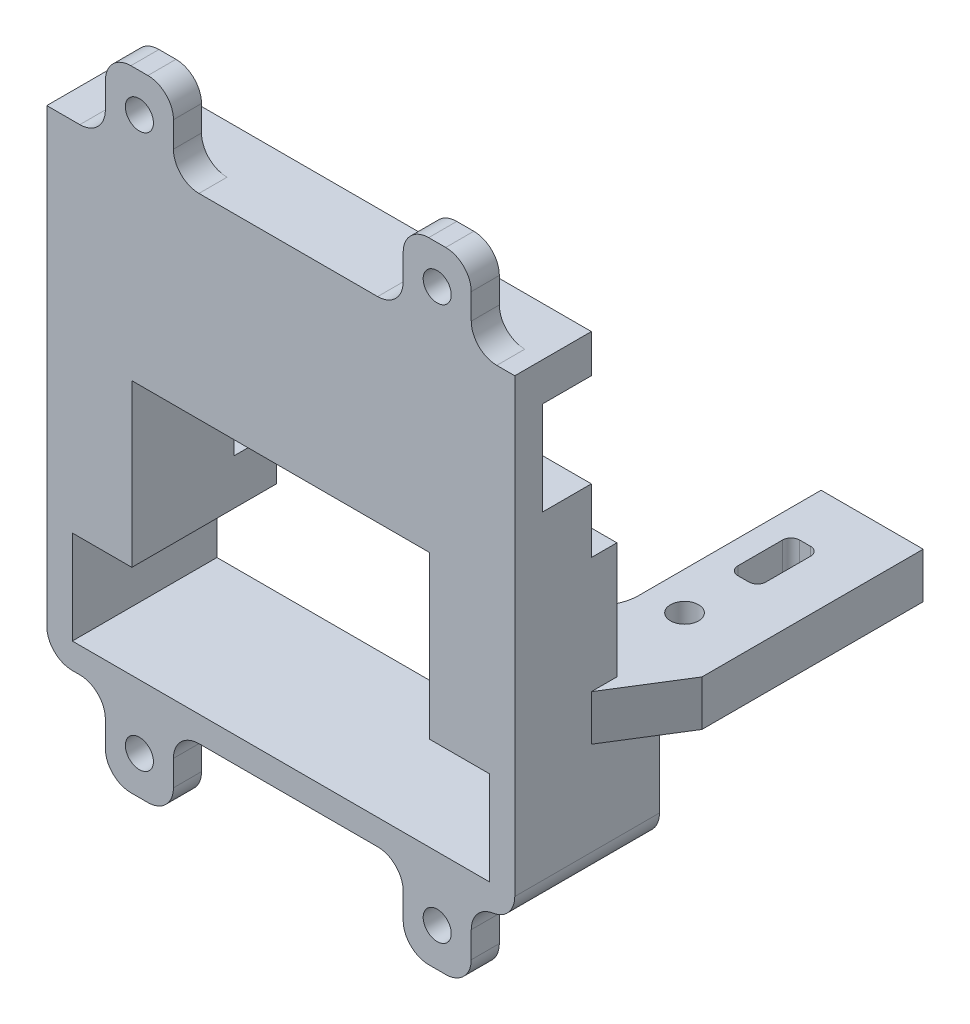
from build123d import *

# Parameters (mm, degrees)
SKETCH_1_W           = 7
SKETCH_1_H           = 21
SKETCH_1_R           = 1.65
EXTRUDE_1_DEPTH      = 3
EXTRUDE_1_2_DEPTH    = 3
SKETCH_2_W           = 55
SKETCH_2_H           = 30
EXTRUDE_2_DEPTH      = 3
SKETCH_3_W           = 55
SKETCH_3_H           = 30
EXTRUDE_3_DEPTH      = 14
SKETCH_4_W           = 55
SKETCH_4_H           = 17
EXTRUDE_4_DEPTH      = 22
SKETCH_5_W           = 66.735039671
SKETCH_5_H           = 6
CUT_EXTRUDE_1_DEPTH  = 13.75
CUT_EXTRUDE_2_DEPTH  = 20
SKETCH2_W            = 7
SKETCH2_H            = 21
SKETCH2_R            = 1.65
BOSS_EXTRUDE1_DEPTH  = 3
SKETCH3_W            = 7
SKETCH3_H            = 6
BOSS_EXTRUDE2_DEPTH  = 5
SKETCH4_W            = 3
SKETCH4_H            = 6
BOSS_EXTRUDE3_DEPTH  = 41
SKETCH5_W            = 8
SKETCH5_H            = 9
SKETCH5_R            = 1.65
BOSS_EXTRUDE4_DEPTH  = 3.3
FILLET1_R            = 5
FILLET2_R            = 3
FILLET3_R            = 3
SKETCH6_W            = 55
SKETCH6_H            = 17
BOSS_EXTRUDE5_DEPTH  = 4
MIRROR2_START        = 24.2
MIRROR2_OUTLINE_R    = 1.65
MIRROR2_DEPTH        = 3.3
FILLET4_R            = 3
SKETCH8_W            = 55
SKETCH8_H            = 7
CUT_EXTRUDE1_DEPTH   = 8
SKETCH10_R           = 1.65
BOSS_EXTRUDE6_DEPTH  = 10
CUT_EXTRUDE2_DEPTH   = 10
SKETCH12_W           = 55
SKETCH12_H           = 13.75
CUT_EXTRUDE3_DEPTH   = 2.5
CUT_EXTRUDE4_DEPTH   = 10
SKETCH15_W           = 41
SKETCH15_H           = 3
CUT_EXTRUDE5_DEPTH   = 60.476886267
SKETCH17_W           = 55
SKETCH17_H           = 5.75
CUT_EXTRUDE6_DEPTH   = 2.5
BOSS_EXTRUDE8_DEPTH  = 17
SKETCH19_W           = 55
SKETCH19_H           = 7.5
CUT_EXTRUDE8_DEPTH   = 8
SKETCH20_W           = 10
SKETCH20_H           = 13
CUT_EXTRUDE9_DEPTH   = 5
SKETCH16_W           = 26
SKETCH16_H           = 6
BOSS_EXTRUDE9_DEPTH  = 5
BOSS_EXTRUDE10_DEPTH = 6
SKETCH23_R           = 1.65
CUT_EXTRUDE10_DEPTH  = 0.65


# Read off the part's stored shape, not the designer's step: Mirror2
with BuildPart() as part:
    # 草图1 → 凸台-拉伸1 (new body)
    with BuildSketch(Plane(origin=(0, 0, 0), x_dir=(1, 0, 0), z_dir=(0, 1, 0))):
        with Locations((-24, 0)):
            Rectangle(SKETCH_1_W, SKETCH_1_H)
        with Locations(Location((-24.95, -5, 0), (0, 0, 270))):
            Circle(SKETCH_1_R, mode=Mode.SUBTRACT)
        with Locations(Location((-24.95, 5, 0), (0, 0, 270))):
            Circle(SKETCH_1_R, mode=Mode.SUBTRACT)
    extrude(amount=-EXTRUDE_1_DEPTH)



with BuildPart() as body_2:
    # 草图1 → Extrude 1 2 (new body)
    with BuildSketch(Plane(origin=(0, 0, 0), x_dir=(1, 0, 0), z_dir=(0, 1, 0))):
        with Locations((24, 0)):
            Rectangle(SKETCH_1_W, SKETCH_1_H)
        with Locations(Location((24.95, -5, 0), (0, 0, 270))):
            Circle(SKETCH_1_R, mode=Mode.SUBTRACT)
        with Locations(Location((24.95, 5, 0), (0, 0, 270))):
            Circle(SKETCH_1_R, mode=Mode.SUBTRACT)
    extrude(amount=-EXTRUDE_1_2_DEPTH)


with BuildPart() as part_1:
    add(part.part)

    add(body_2.part)  # 凸台-拉伸2 merges body 2
    # 草图2 → 凸台-拉伸2 (add)
    with BuildSketch(Plane.XY.offset(10.5)):
        with Locations((0, -15)):
            Rectangle(SKETCH_2_W, SKETCH_2_H)
    extrude(amount=EXTRUDE_2_DEPTH)

    # 草图3 → 凸台-拉伸3 (add)
    with BuildSketch(Plane.XY.offset(13.5)):
        with Locations((0, -15)):
            Rectangle(SKETCH_3_W, SKETCH_3_H)
    extrude(amount=EXTRUDE_3_DEPTH)

    # 草图4 → 凸台-拉伸4 (add)
    with BuildSketch(Plane(origin=(0, 0, 0), x_dir=(1, 0, 0), z_dir=(0, 1, 0))):
        with Locations((0, -19)):
            Rectangle(SKETCH_4_W, SKETCH_4_H)
    extrude(amount=EXTRUDE_4_DEPTH)

    # 草图5 → 切除-拉伸1 (cut)
    with BuildSketch(Plane(origin=(0, 0, 10.5), x_dir=(-1, 0, 0), z_dir=(0, 0, -1))):
        with Locations((1.017100612, 16)):
            Rectangle(SKETCH_5_W, SKETCH_5_H)
    extrude(amount=-CUT_EXTRUDE_1_DEPTH, mode=Mode.SUBTRACT)

    # 草图6 → 切除-拉伸2 (cut)
    with BuildSketch(Plane(origin=(0, 0, 10.5), x_dir=(-1, 0, 0), z_dir=(0, 0, -1))):
        Polygon((-24.5, 3), (-17.5, 3), (-17.5, -6), (-24.5, -6), (-24.5, -27), (24.5, -27), (24.5, -6), (17.5, -6), (17.5, 3), (24.5, 3), (24.5, 10), (-24.5, 10), align=None)
    extrude(amount=-CUT_EXTRUDE_2_DEPTH, mode=Mode.SUBTRACT)

    # Sketch2 → Boss-Extrude1 (add)
    # profile 1 of 2: a face of its own
    with BuildSketch(Plane.XZ.offset(3)):
        with Locations((24, 0)):
            Rectangle(SKETCH2_W, SKETCH2_H)
        with Locations(Location((24.95, -5, 0), (0, 0, 90))):
            Circle(SKETCH2_R, mode=Mode.SUBTRACT)
        with Locations(Location((24.95, 5, 0), (0, 0, 90))):
            Circle(SKETCH2_R, mode=Mode.SUBTRACT)
    # profile 2 of 2: a face of its own
    with BuildSketch(Plane.XZ.offset(3)):
        with Locations((-24, 0)):
            Rectangle(SKETCH2_W, SKETCH2_H)
        with Locations(Location((-24.95, -5, 0), (0, 0, 90))):
            Circle(SKETCH2_R, mode=Mode.SUBTRACT)
        with Locations(Location((-24.95, 5, 0), (0, 0, 90))):
            Circle(SKETCH2_R, mode=Mode.SUBTRACT)
    extrude(amount=BOSS_EXTRUDE1_DEPTH)

    # Sketch3 → Boss-Extrude2 (add)
    with BuildSketch(Plane(origin=(0, 0, -10.5), x_dir=(-1, 0, 0), z_dir=(0, 0, -1))):
        with Locations((-24, -3)):
            Rectangle(SKETCH3_W, SKETCH3_H)
        with Locations((24, -3)):
            Rectangle(SKETCH3_W, SKETCH3_H)
    extrude(amount=BOSS_EXTRUDE2_DEPTH)

    # Sketch4 → Boss-Extrude3 (add)
    with BuildSketch(Plane.ZY.offset(-20.5)):
        with Locations((-14, -3)):
            Rectangle(SKETCH4_W, SKETCH4_H)
    extrude(amount=BOSS_EXTRUDE3_DEPTH)

    # Sketch5 → Boss-Extrude4 (add)
    # profile 1 of 2: a face of its own
    with BuildSketch(Plane.XY.offset(27.5)):
        with Locations((18.383478606, -34.5)):
            Rectangle(SKETCH5_W, SKETCH5_H)
        with Locations((18.383478606, -34.5)):
            Circle(SKETCH5_R, mode=Mode.SUBTRACT)
    # profile 2 of 2: a face of its own
    with BuildSketch(Plane.XY.offset(27.5)):
        with Locations((-16.616521394, -34.5)):
            Rectangle(SKETCH5_W, SKETCH5_H)
        with Locations((-16.616521394, -34.5)):
            Circle(SKETCH5_R, mode=Mode.SUBTRACT)
    extrude(amount=-BOSS_EXTRUDE4_DEPTH)

    # Fillet1
    # the kernel refuses this fillet: 5 mm, written as the material it adds along each edge
    with BuildSketch(Plane(origin=(-20.5, 0, 10.5), x_dir=(1, 0, 0), z_dir=(0, -1, 0)), Plane(origin=(20.5, -6, 10.5), x_dir=(-1, 0, 0), z_dir=(0, 1, 0))) as fillet1_piece_1:
        with BuildLine():
            CenterArc((5, -4.582575695), FILLET1_R, 113.578178478, 66.421821522)
            Line((0, -4.582575695), (-0.1, -4.582575695))
            Line((-0.1, -4.582575695), (-0.1, 0))
            Line((-0.1, 0), (0, 0.1))
            ThreePointArc((0, 0.1), (1.5, 0.1), (2.96, 0.091651514))
            Line((2.96, 0.091651514), (3, 0))
        make_face()
    extrude(amount=6)

    # Fillet2
    fillet2_edges = [part_1.edges().sort_by_distance(p)[0] for p in [
        (24.5, 3, 19),
        (-24.5, 3, 19),
        (-27.5, -30, 19),
        (27.5, -30, 19),
    ]]
    fillet(fillet2_edges, radius=FILLET2_R)

    # Fillet3
    # the kernel refuses this fillet: 3 mm, written as the material it adds along each edge
    with BuildSketch(Plane(origin=(-20.616521394, -30, 27.5), x_dir=(-1, 0, 0), z_dir=(0, 0, -1)), Plane(origin=(14.383478606, -30, 27.5), x_dir=(-1, 0, 0), z_dir=(0, 0, -1))) as fillet3_piece_1:
        with BuildLine():
            CenterArc((FILLET3_R, -FILLET3_R), FILLET3_R, 90, 90)
            Line((0, -FILLET3_R), (0, 0))
            Line((0, 0), (FILLET3_R, 0))
        make_face()
    extrude(amount=3.3)
    with BuildSketch(Plane(origin=(-12.616521394, -30, 27.5), x_dir=(1, 0, 0), z_dir=(0, 0, -1))) as fillet3_piece_2:
        with BuildLine():
            CenterArc((FILLET3_R, FILLET3_R), FILLET3_R, 180, 90)
            Line((0, FILLET3_R), (0, 0))
            Line((0, 0), (FILLET3_R, 0))
        make_face()
    extrude(amount=3.3)
    with BuildSketch(Plane(origin=(22.383478606, -30, 27.5), x_dir=(0.9999183162467798, 0.012781268880858251, 0), z_dir=(0, 0, -1))) as fillet3_piece_3:
        with BuildLine():
            CenterArc((2.96224705, 2.97270312), FILLET3_R, 180.732332704, 81.532613054)
            Line((-0.037507899, 2.934359313), (-0.337483394, 2.930524932))
            Line((-0.337483394, 2.930524932), (-0.299975495, -0.003834381))
            Line((-0.299975495, -0.003834381), (0.003834381, -0.299975495))
            ThreePointArc((0.003834381, -0.299975495), (2.12018289, -0.272923666), (2.518091946, -0.297270312))
            Line((2.518091946, -0.297270312), (2.558469683, 0))
        make_face()
    extrude(amount=3.3)
    # the kernel refuses this fillet: 3 mm, written as the material it takes off along each edge
    with BuildSketch(Plane(origin=(-12.616521394, -39, 35), x_dir=(0, 1, 0), z_dir=(0, 0, -1)), Plane(origin=(-20.616521394, -39, 35), x_dir=(1, 0, 0), z_dir=(0, 0, -1)), Plane(origin=(22.383478606, -39, 35), x_dir=(0, 1, 0), z_dir=(0, 0, -1)), Plane(origin=(14.383478606, -39, 35), x_dir=(1, 0, 0), z_dir=(0, 0, -1))) as fillet3_2_piece_1:
        with BuildLine():
            CenterArc((FILLET3_R, -FILLET3_R), FILLET3_R, 90, 90)
            Line((0, -FILLET3_R), (0, 0))
            Line((0, 0), (FILLET3_R, 0))
        make_face()
    extrude(amount=18.3, mode=Mode.SUBTRACT)

    # Sketch6 → Boss-Extrude5 (add)
    with BuildSketch(Plane(origin=(0, 22, 0), x_dir=(1, 0, 0), z_dir=(0, 1, 0))):
        with Locations((0, -19)):
            Rectangle(SKETCH6_W, SKETCH6_H)
    extrude(amount=BOSS_EXTRUDE5_DEPTH)

    # Mirror2 outline → Mirror2 (add)
    # profile 1 of 2: a face of its own
    with BuildSketch(Plane.XY.offset(MIRROR2_START)):
        with BuildLine():
            Line((14.383478606, 32), (14.383478606, 26))
            Line((14.383478606, 26), (22.383478606, 26))
            Line((22.383478606, 26), (22.383478606, 32))
            ThreePointArc((22.383478606, 32), (21.504798949, 34.121320343), (19.383478606, 35))
            Line((19.383478606, 35), (17.383478606, 35))
            ThreePointArc((17.383478606, 35), (15.262158262, 34.121320344), (14.383478606, 32))
        make_face()
        with Locations((18.383478606, 30.5)):
            Circle(MIRROR2_OUTLINE_R, mode=Mode.SUBTRACT)
    # profile 2 of 2: a face of its own
    with BuildSketch(Plane.XY.offset(MIRROR2_START)):
        with BuildLine():
            Line((-20.616521394, 26), (-12.616521394, 26))
            Line((-12.616521394, 26), (-12.616521394, 32))
            ThreePointArc((-12.616521394, 32), (-13.495201051, 34.121320343), (-15.616521394, 35))
            Line((-15.616521394, 35), (-17.616521394, 35))
            ThreePointArc((-17.616521394, 35), (-19.737841738, 34.121320344), (-20.616521394, 32))
            Line((-20.616521394, 32), (-20.616521394, 26))
        make_face()
        with Locations((-16.616521394, 30.5)):
            Circle(MIRROR2_OUTLINE_R, mode=Mode.SUBTRACT)
    extrude(amount=MIRROR2_DEPTH)

    # Fillet4
    fillet4_edges = [part_1.edges().sort_by_distance(p)[0] for p in [
        (-12.616521394, 26, 25.85),
        (-20.616521394, 26, 25.85),
        (22.383478606, 26, 25.85),
        (14.383478606, 26, 25.85),
    ]]
    fillet(fillet4_edges, radius=FILLET4_R)

    # Sketch8 → Cut-Extrude1 (cut)
    with BuildSketch(Plane(origin=(0, 0, 10.5), x_dir=(-1, 0, 0), z_dir=(0, 0, -1))):
        with Locations((0, 22.5)):
            Rectangle(SKETCH8_W, SKETCH8_H)
    extrude(amount=-CUT_EXTRUDE1_DEPTH, mode=Mode.SUBTRACT)

    # Sketch10 → Boss-Extrude6 (add)
    with BuildSketch(Plane.XZ.offset(6)):
        with BuildLine():
            Line((-17.5, 27.5), (-24.5, 27.5))
            Line((-24.5, 27.5), (-24.5, 10.5))
            Line((-24.5, 10.5), (-27.5, 10.5))
            Line((-27.5, 10.5), (-27.5, -15.5))
            Line((-27.5, -15.5), (27.5, -15.5))
            Line((27.5, -15.5), (27.5, 10.5))
            Line((27.5, 10.5), (24.5, 10.5))
            Line((24.5, 10.5), (24.5, 27.5))
            Line((24.5, 27.5), (17.5, 27.5))
            Line((17.5, 27.5), (17.5, 10.5))
            ThreePointArc((17.5, 10.5), (19.683300133, 8.656037093), (20.5, 5.917424305))
            Line((20.5, 5.917424305), (20.5, -12.5))
            Line((20.5, -12.5), (-20.5, -12.5))
            Line((-20.5, -12.5), (-20.5, 5.917424305))
            ThreePointArc((-20.5, 5.917424305), (-19.683300133, 8.656037093), (-17.5, 10.5))
            Line((-17.5, 10.5), (-17.5, 27.5))
        make_face()
        with Locations(Location((24.95, -5, 0), (0, 0, 90))):
            Circle(SKETCH10_R, mode=Mode.SUBTRACT)
        with Locations(Location((24.95, 5, 0), (0, 0, 90))):
            Circle(SKETCH10_R, mode=Mode.SUBTRACT)
        with Locations(Location((-24.95, 5, 0), (0, 0, 90))):
            Circle(SKETCH10_R, mode=Mode.SUBTRACT)
        with Locations(Location((-24.95, -5, 0), (0, 0, 90))):
            Circle(SKETCH10_R, mode=Mode.SUBTRACT)
    extrude(amount=BOSS_EXTRUDE6_DEPTH)

    # Sketch11 → Cut-Extrude2 (cut)
    with BuildSketch(Plane(origin=(0, 0, 0), x_dir=(1, 0, 0), z_dir=(0, 1, 0))):
        with BuildLine():
            Line((-27.5, -10.5), (-17.5, -10.5))
            ThreePointArc((-17.5, -10.5), (-19.683300133, -8.656037093), (-20.5, -5.917424305))
            Line((-20.5, -5.917424305), (-20.5, 12.5))
            Line((-20.5, 12.5), (20.5, 12.5))
            Line((20.5, 12.5), (20.5, -5.917424305))
            ThreePointArc((20.5, -5.917424305), (19.683300133, -8.656037093), (17.5, -10.5))
            Line((17.5, -10.5), (27.5, -10.5))
            Line((27.5, -10.5), (27.5, 15.5))
            Line((27.5, 15.5), (-27.5, 15.5))
            Line((-27.5, 15.5), (-27.5, -10.5))
        make_face()
    extrude(amount=-CUT_EXTRUDE2_DEPTH, mode=Mode.SUBTRACT)

    # Sketch12 → Cut-Extrude3 (cut)
    with BuildSketch(Plane(origin=(0, 13, 0), x_dir=(1, 0, 0), z_dir=(0, 1, 0))):
        with Locations((0, -17.375)):
            Rectangle(SKETCH12_W, SKETCH12_H)
    extrude(amount=-CUT_EXTRUDE3_DEPTH, mode=Mode.SUBTRACT)

    # Sketch14 → Cut-Extrude4 (cut)
    with BuildSketch(Plane(origin=(0, -10, 0), x_dir=(1, 0, 0), z_dir=(0, 1, 0))):
        with BuildLine():
            Line((-25.6, 9.171971899), (-24.3, 9.171971899))
            ThreePointArc((-24.3, 9.171971899), (-23.592893219, 8.87907868), (-23.3, 8.171971899))
            Line((-23.3, 8.171971899), (-23.3, 2.912528276))
            ThreePointArc((-23.3, 2.912528276), (-23.592893219, 2.205421495), (-24.3, 1.912528276))
            Line((-24.3, 1.912528276), (-25.6, 1.912528276))
            ThreePointArc((-25.6, 1.912528276), (-26.307106781, 2.205421495), (-26.6, 2.912528276))
            Line((-26.6, 2.912528276), (-26.6, 8.171971899))
            ThreePointArc((-26.6, 8.171971899), (-26.307106781, 8.87907868), (-25.6, 9.171971899))
        make_face()
        with BuildLine():
            Line((23.3, 8.171971899), (23.3, 2.912528276))
            ThreePointArc((23.3, 2.912528276), (23.592893219, 2.205421495), (24.3, 1.912528276))
            Line((24.3, 1.912528276), (25.6, 1.912528276))
            ThreePointArc((25.6, 1.912528276), (26.307106781, 2.205421495), (26.6, 2.912528276))
            Line((26.6, 2.912528276), (26.6, 8.171971899))
            ThreePointArc((26.6, 8.171971899), (26.307106781, 8.87907868), (25.6, 9.171971899))
            Line((25.6, 9.171971899), (24.3, 9.171971899))
            ThreePointArc((24.3, 9.171971899), (23.592893219, 8.87907868), (23.3, 8.171971899))
        make_face()
    extrude(amount=-CUT_EXTRUDE4_DEPTH, mode=Mode.SUBTRACT)

    # Sketch15 → Cut-Extrude5 (cut, through all)
    with BuildSketch(Plane(origin=(0, -10, 0), x_dir=(1, 0, 0), z_dir=(0, 1, 0))):
        with Locations((0, 14)):
            Rectangle(SKETCH15_W, SKETCH15_H)
    extrude(amount=-CUT_EXTRUDE5_DEPTH, mode=Mode.SUBTRACT)

    # Sketch17 → Cut-Extrude6 (cut)
    with BuildSketch(Plane.XZ.offset(-19)):
        with Locations((0, 21.375)):
            Rectangle(SKETCH17_W, SKETCH17_H)
    extrude(amount=-CUT_EXTRUDE6_DEPTH, mode=Mode.SUBTRACT)

    # Sketch18 → Boss-Extrude8 (add)
    with BuildSketch(Plane.XY.offset(27.5)):
        with BuildLine():
            Line((-24.5, 10), (-24.5, 6))
            ThreePointArc((-24.5, 6), (-23.621320344, 3.878679656), (-21.5, 3))
            Line((-21.5, 3), (-17.5, 3))
            Line((-17.5, 3), (-1.213612242, 3))
            Line((-1.213612242, 3), (21.5, 3))
            ThreePointArc((21.5, 3), (23.621320344, 3.878679656), (24.5, 6))
            Line((24.5, 6), (24.5, 10))
            Line((24.5, 10), (-1.213612242, 10))
            Line((-1.213612242, 10), (-24.5, 10))
        make_face()
    extrude(amount=-BOSS_EXTRUDE8_DEPTH)

    # Sketch19 → Cut-Extrude8 (cut)
    with BuildSketch(Plane(origin=(0, 0, 10.5), x_dir=(-1, 0, 0), z_dir=(0, 0, -1))):
        with Locations((0, 6.75)):
            Rectangle(SKETCH19_W, SKETCH19_H)
    extrude(amount=-CUT_EXTRUDE8_DEPTH, mode=Mode.SUBTRACT)

    # Sketch20 → Cut-Extrude9 (cut)
    with BuildSketch(Plane(origin=(0, 0, 10.5), x_dir=(-1, 0, 0), z_dir=(0, 0, -1))):
        with Locations((22.5, -3.5)):
            Rectangle(SKETCH20_W, SKETCH20_H)
        with Locations((-22.5, -3.5)):
            Rectangle(SKETCH20_W, SKETCH20_H)
    extrude(amount=-CUT_EXTRUDE9_DEPTH, mode=Mode.SUBTRACT)

    # Sketch16 → Boss-Extrude9 (add)
    with BuildSketch(Plane.ZY.offset(27.5)):
        with Locations((-2.5, -13)):
            Rectangle(SKETCH16_W, SKETCH16_H)
    boss_extrude9 = extrude(amount=BOSS_EXTRUDE9_DEPTH)

    # Sketch22 → Boss-Extrude10 (add)
    with BuildSketch(Plane(origin=(0, -10, 0), x_dir=(1, 0, 0), z_dir=(0, 1, 0))):
        Polygon((-32.5, -10.5), (-27.5, -18.5), (-27.5, -10.5), align=None)
    boss_extrude10 = extrude(amount=-BOSS_EXTRUDE10_DEPTH)

    # Mirror3: Boss-Extrude9, Boss-Extrude10 across plane
    add(boss_extrude9.mirror(Plane(origin=(0, 0, 0), x_dir=(0, 0, 1), z_dir=(1, 0, 0))))
    add(boss_extrude10.mirror(Plane(origin=(0, 0, 0), x_dir=(0, 0, 1), z_dir=(1, 0, 0))))

    # Sketch23 → Cut-Extrude10 (cut)
    # profile 1 of 2: a face of its own
    with BuildSketch(Plane(origin=(0, -10, 0), x_dir=(1, 0, 0), z_dir=(0, 1, 0))):
        with BuildLine():
            Line((32.5, 15.5), (20.5, 15.5))
            Line((20.5, 15.5), (20.5, -5.917424305))
            ThreePointArc((20.5, -5.917424305), (19.683300133, -8.656037093), (17.5, -10.5))
            Line((17.5, -10.5), (17.5, -15.5))
            Line((17.5, -15.5), (27.5, -15.5))
            Line((27.5, -15.5), (27.5, -18.5))
            Line((27.5, -18.5), (32.5, -10.5))
            Line((32.5, -10.5), (32.5, 15.5))
        make_face()
        with Locations(Location((24.95, -5, 0), (0, 0, 90))):
            Circle(SKETCH23_R, mode=Mode.SUBTRACT)
        with BuildLine():
            Line((25.6, 1.912528276), (24.3, 1.912528276))
            ThreePointArc((24.3, 1.912528276), (23.592893219, 2.205421495), (23.3, 2.912528276))
            Line((23.3, 2.912528276), (23.3, 8.171971899))
            ThreePointArc((23.3, 8.171971899), (23.592893219, 8.87907868), (24.3, 9.171971899))
            Line((24.3, 9.171971899), (25.6, 9.171971899))
            ThreePointArc((25.6, 9.171971899), (26.307106781, 8.87907868), (26.6, 8.171971899))
            Line((26.6, 8.171971899), (26.6, 2.912528276))
            ThreePointArc((26.6, 2.912528276), (26.307106781, 2.205421495), (25.6, 1.912528276))
        make_face(mode=Mode.SUBTRACT)
    # profile 2 of 2: a face of its own
    with BuildSketch(Plane(origin=(0, -10, 0), x_dir=(1, 0, 0), z_dir=(0, 1, 0))):
        with BuildLine():
            Line((-20.5, -5.917424305), (-20.5, 15.5))
            Line((-20.5, 15.5), (-32.5, 15.5))
            Line((-32.5, 15.5), (-32.5, -10.5))
            Line((-32.5, -10.5), (-27.5, -18.5))
            Line((-27.5, -18.5), (-27.5, -15.5))
            Line((-27.5, -15.5), (-17.5, -15.5))
            Line((-17.5, -15.5), (-17.5, -10.5))
            ThreePointArc((-17.5, -10.5), (-19.683300133, -8.656037093), (-20.5, -5.917424305))
        make_face()
        with Locations(Location((-24.95, -5, 0), (0, 0, 270))):
            Circle(SKETCH23_R, mode=Mode.SUBTRACT)
        with BuildLine():
            Line((-24.3, 9.171971899), (-25.6, 9.171971899))
            ThreePointArc((-25.6, 9.171971899), (-26.307106781, 8.87907868), (-26.6, 8.171971899))
            Line((-26.6, 8.171971899), (-26.6, 2.912528276))
            ThreePointArc((-26.6, 2.912528276), (-26.307106781, 2.205421495), (-25.6, 1.912528276))
            Line((-25.6, 1.912528276), (-24.3, 1.912528276))
            ThreePointArc((-24.3, 1.912528276), (-23.592893219, 2.205421495), (-23.3, 2.912528276))
            Line((-23.3, 2.912528276), (-23.3, 8.171971899))
            ThreePointArc((-23.3, 8.171971899), (-23.592893219, 8.87907868), (-24.3, 9.171971899))
        make_face(mode=Mode.SUBTRACT)
    extrude(amount=-CUT_EXTRUDE10_DEPTH, mode=Mode.SUBTRACT)


solid = part_1.part
